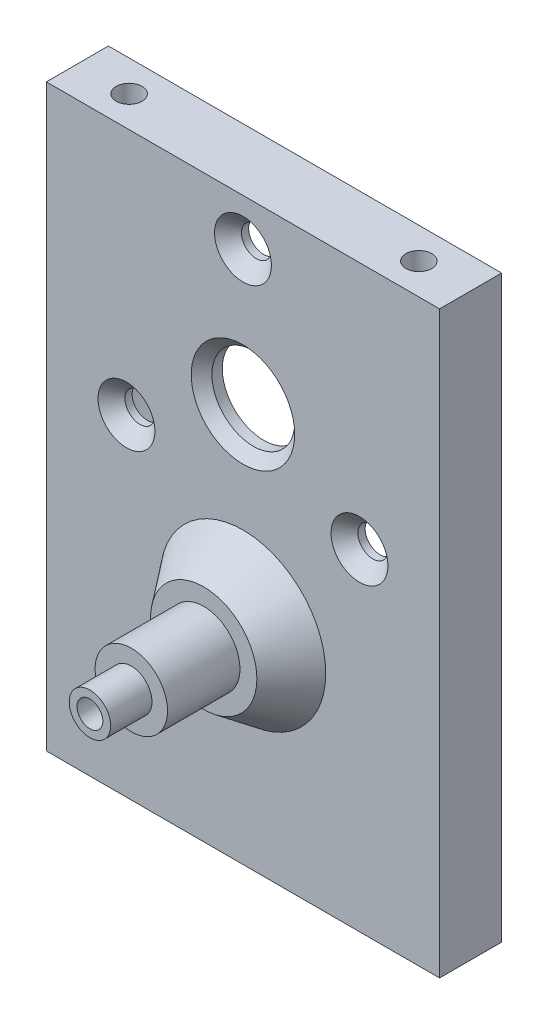
from build123d import *

# Parameters (mm, degrees)
ESBO_O1_W                                            = 38
ESBO_O1_H                                            = 56
ESBO_O1_R                                            = 4
RESSALTO_EXTRUS_O1_DEPTH                             = 6
ESBO_O6_R                                            = 16.54
CORTE_EXTRUS_O5_DEPTH                                = 4
ESBO_O7_R                                            = 4
ESBO_O7_R_2                                          = 1.25
CORTE_EXTRUS_O6_DEPTH                                = 60.270566051
ESCAREADO_PARA_PARAFUSO_DE_M_QUINA_COM_C_D           = 2.9
ESCAREADO_PARA_PARAFUSO_DE_M_QUINA_COM_C_CSINK_D     = 5.5
ESCAREADO_PARA_PARAFUSO_DE_M_QUINA_COM_C_CSINK_ANGLE = 90
RESSALTO_EXTRUS_O2_DEPTH                             = 4
RESSALTO_EXTRUS_O3_DEPTH                             = 5.79
ESBO_O17_R                                           = 3.5
RESSALTO_EXTRUS_O4_DEPTH                             = 7
ESBO_O18_R                                           = 2
RESSALTO_EXTRUS_O5_DEPTH                             = 4
CHANFRO1_SIZE                                        = 4
CHANFRO1_SIZE_2                                      = 5.29
FURO_ROSCADO_DE_M3X0_51_D                            = 2.5
FURO_ROSCADO_DE_M3X0_51_DEPTH                        = 10
FURO_ROSCADO_DE_M3X0_51_TIP                          = 0.751075774
FURO_ROSCADO_DE_M3X0_52_D                            = 2.5
FURO_ROSCADO_DE_M3X0_52_DEPTH                        = 8.5
FURO_ROSCADO_DE_M3X0_52_TIP                          = 0.751075774
FURO_ROSCADO_DE_M3X0_53_D                            = 2.5
FURO_ROSCADO_DE_M3X0_53_DEPTH                        = 6
FURO_ROSCADO_DE_M3X0_53_TIP                          = 0.751075774
CHANFRO2_SIZE                                        = 1


with BuildPart() as part:
    # Esboço1 → Ressalto-extrusão1 (new body)
    with BuildSketch(Plane.XY):
        with Locations((0, 28)):
            Rectangle(ESBO_O1_W, ESBO_O1_H)
        with Locations((0, 20)):
            Circle(ESBO_O1_R, mode=Mode.SUBTRACT)
    extrude(amount=RESSALTO_EXTRUS_O1_DEPTH)

    # Esboço6 → Corte-extrusão5 (cut)
    with BuildSketch(Plane(origin=(0, 0, 0), x_dir=(-1, 0, 0), z_dir=(0, 0, -1))):
        with Locations((0, 38.5)):
            Circle(ESBO_O6_R)
    extrude(amount=-CORTE_EXTRUS_O5_DEPTH, mode=Mode.SUBTRACT)

    # Esboço7 → Corte-extrusão6 (cut, through all)
    with BuildSketch(Plane(origin=(0, 0, 4), x_dir=(-1, 0, 0), z_dir=(0, 0, -1))):
        with Locations((0, 38.5)):
            Circle(ESBO_O7_R)
        with Locations((11.258330249, 32)):
            Circle(ESBO_O7_R_2)
        with Locations((-11.258330249, 32)):
            Circle(ESBO_O7_R_2)
        with Locations((0, 51.5)):
            Circle(ESBO_O7_R_2)
    extrude(amount=-CORTE_EXTRUS_O6_DEPTH, mode=Mode.SUBTRACT)

    # Escareado para parafuso de máquina com cabeça chata de M2.51 (through all)
    with Locations(Plane.XY.offset(6)):
        with Locations((0, 51.5), (11.258330249, 32), (-11.258330249, 32)):
            CounterSinkHole(ESCAREADO_PARA_PARAFUSO_DE_M_QUINA_COM_C_D / 2, ESCAREADO_PARA_PARAFUSO_DE_M_QUINA_COM_C_CSINK_D / 2, counter_sink_angle=ESCAREADO_PARA_PARAFUSO_DE_M_QUINA_COM_C_CSINK_ANGLE)

    # Esboço15 → Ressalto-extrusão2 (add)
    with BuildSketch(Plane(origin=(0, 0, 0), x_dir=(-1, 0, 0), z_dir=(0, 0, -1))):
        with BuildLine():
            ThreePointArc((-3.280592218, 22.288605405), (0, 16), (3.280592218, 22.288605405))
            ThreePointArc((3.280592218, 22.288605405), (0, 21.96), (-3.280592218, 22.288605405))
        make_face()
    extrude(amount=-RESSALTO_EXTRUS_O2_DEPTH)

    # Esboço16 → Ressalto-extrusão3 (add)
    with BuildSketch(Plane.XY.offset(4)):
        with BuildLine():
            ThreePointArc((-3.280592218, 22.288605405), (0, 16), (3.280592218, 22.288605405))
            ThreePointArc((3.280592218, 22.288605405), (0, 24), (-3.280592218, 22.288605405))
        make_face()
    extrude(amount=RESSALTO_EXTRUS_O3_DEPTH)

    # Esboço17 → Ressalto-extrusão4 (add)
    with BuildSketch(Plane.XY.offset(9.79)):
        with Locations((0, 20)):
            Circle(ESBO_O17_R)
    extrude(amount=RESSALTO_EXTRUS_O4_DEPTH)

    # Esboço18 → Ressalto-extrusão5 (add)
    with BuildSketch(Plane.XY.offset(16.79)):
        with Locations((0, 20)):
            Circle(ESBO_O18_R)
    extrude(amount=RESSALTO_EXTRUS_O5_DEPTH)

    # Chanfro1
    # the kernel refuses this chamfer: 5.29, 4 mm, written as the material it adds along each edge
    with BuildSketch(Plane(origin=(0, 20, 6), x_dir=(0.8201480544065356, 0.5721513513513485, 0), z_dir=(-0.5721513513513485, 0.8201480544065356, 0))) as chanfro1_piece_1_section:
        Polygon((4 + CHANFRO1_SIZE, 0), (4, -CHANFRO1_SIZE_2), (4, 0), align=None)
    chanfro1_piece_1 = revolve(axis=Axis((0, 20, 6), (0, 0, -1)), mode=Mode.PRIVATE)
    chanfro1_piece_1 = split(chanfro1_piece_1, bisect_by=Plane(origin=(-5.391672126, 16.23866389, 9.79), z_dir=(0, 0, -1)), keep=Keep.TOP, mode=Mode.PRIVATE)
    add(chanfro1_piece_1)

    # Furo roscado de M3x0.51
    with Locations(Plane.XY.offset(20.79)):
        with Locations((0, 20)):
            Hole(FURO_ROSCADO_DE_M3X0_51_D / 2, depth=FURO_ROSCADO_DE_M3X0_51_DEPTH)
            with Locations((0, 0, -(FURO_ROSCADO_DE_M3X0_51_DEPTH + FURO_ROSCADO_DE_M3X0_51_TIP / 2))):  # 118° drill point
                Cone(0, FURO_ROSCADO_DE_M3X0_51_D / 2, FURO_ROSCADO_DE_M3X0_51_TIP, mode=Mode.SUBTRACT)

    # Furo roscado de M3x0.52
    with Locations(Plane(origin=(0, 0, 0), x_dir=(-1, 0, 0), z_dir=(0, -1, 0))):
        with Locations((12, -3), (0, -3), (-12, -3)):
            Hole(FURO_ROSCADO_DE_M3X0_52_D / 2, depth=FURO_ROSCADO_DE_M3X0_52_DEPTH)
            with Locations((0, 0, -(FURO_ROSCADO_DE_M3X0_52_DEPTH + FURO_ROSCADO_DE_M3X0_52_TIP / 2))):  # 118° drill point
                Cone(0, FURO_ROSCADO_DE_M3X0_52_D / 2, FURO_ROSCADO_DE_M3X0_52_TIP, mode=Mode.SUBTRACT)

    # Furo roscado de M3x0.53
    with Locations(Plane(origin=(0, 56, 0), x_dir=(1, 0, 0), z_dir=(0, 1, 0))):
        with Locations((-14, -3), (14, -3)):
            Hole(FURO_ROSCADO_DE_M3X0_53_D / 2, depth=FURO_ROSCADO_DE_M3X0_53_DEPTH)
            with Locations((0, 0, -(FURO_ROSCADO_DE_M3X0_53_DEPTH + FURO_ROSCADO_DE_M3X0_53_TIP / 2))):  # 118° drill point
                Cone(0, FURO_ROSCADO_DE_M3X0_53_D / 2, FURO_ROSCADO_DE_M3X0_53_TIP, mode=Mode.SUBTRACT)

    # Chanfro2
    chanfro2_edges = [part.edges().sort_by_distance(p)[0] for p in [
        (4, 38.5, 6),
    ]]
    chamfer(chanfro2_edges, length=CHANFRO2_SIZE)


solid = part.part
